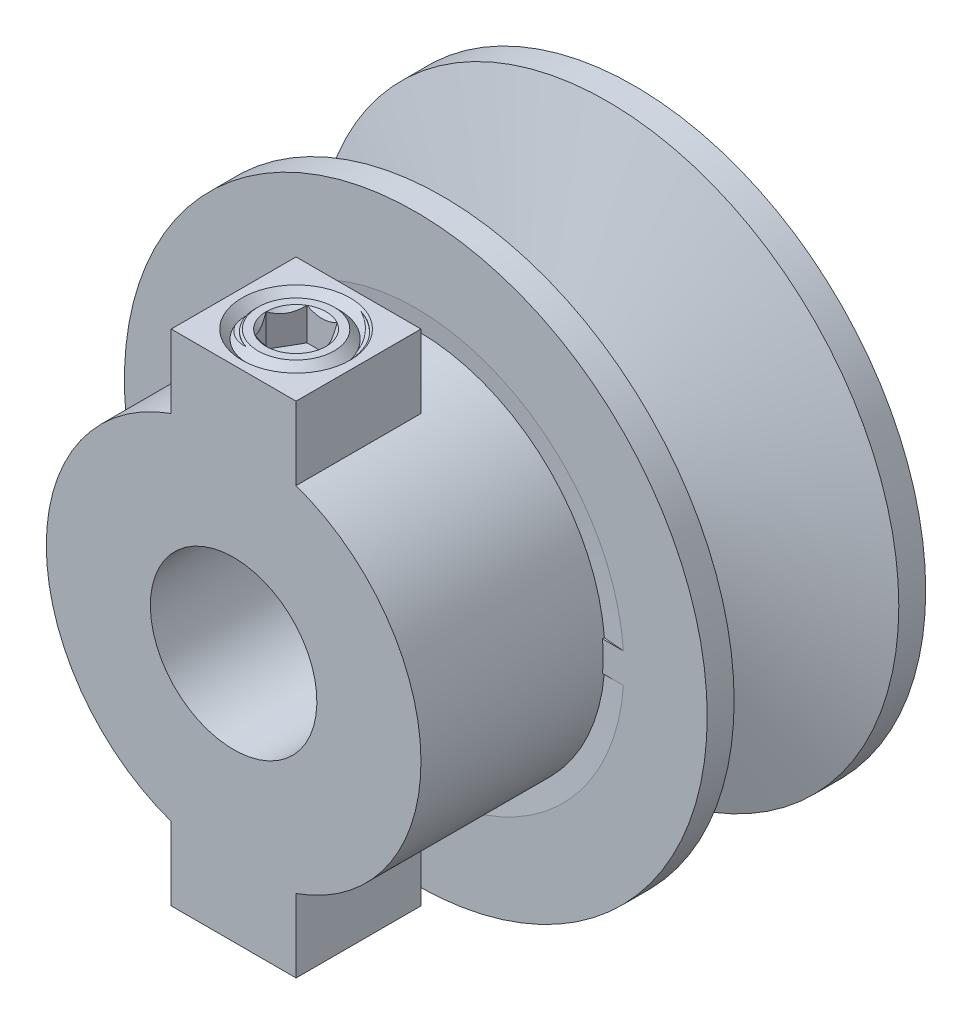
from build123d import *

# Parameters (mm, degrees)
BOSS_EXTRUDE1_DEPTH      = 1.143
CIRPATTERN1_COUNT        = 2
SKETCH3_R                = 6.35
CUT_EXTRUDE1_DEPTH       = 30.5562
BOSS_EXTRUDE2_REACH      = 54.94
BOSS_EXTRUDE2_END_RADIUS = 14.2875
BOSS_EXTRUDE2_START      = 4.7625
SKETCH5_W                = 9.525
SKETCH5_H                = 9.525
CUT_EXTRUDE3_REACH       = 53.88
CUT_EXTRUDE3_END_RADIUS  = 6.35
SKETCH6_R                = 3.086805556
CUT_SWEEP1_PITCH         = 1.411111111
CUT_SWEEP2_PITCH         = 1.411111111
CUT_EXTRUDE5_DEPTH       = 2.48046875


with BuildPart() as part:
    # Sketch1 → Revolve1 (revolve)
    with BuildSketch(Plane(origin=(0, 0, 0), x_dir=(0, 0, -1), z_dir=(1, 0, 0)), mode=Mode.PRIVATE) as revolve1_sk:
        Polygon((6.279294914, 22.225), (8.3312, 22.225), (8.3312, 15.875), (8.192311747, 14.2875), (8.3312, 14.2875), (8.3312, 0), (-22.225, 0), (-22.225, 14.2875), (-8.73125, 14.2875), (-8.192311747, 14.2875), (-8.3312, 15.875), (-8.3312, 22.225), (-6.279294914, 22.225), (-2.396515259, 9.525), (2.396515259, 9.525), align=None)
    revolve(revolve1_sk.sketch.rotate(Axis((0, 0, 22.225), (0, 0, -1)), 90), axis=Axis((0, 0, 22.225), (0, 0, -1)))

    # Sketch2 → Boss-Extrude1 (add, symmetric)
    with BuildSketch(Plane(origin=(0, 0, 0), x_dir=(0, 0, -1), z_dir=(0, 1, 0))):
        Polygon((-8.170089626, 14.0335), (-8.3312, 15.875), (-8.3312, 14.0335), align=None)
        Polygon((8.3312, 14.0335), (8.170089626, 14.0335), (8.3312, 15.875), align=None)
    boss_extrude1 = extrude(amount=BOSS_EXTRUDE1_DEPTH, both=True)

    # CirPattern1: Boss-Extrude1 ×2 about axis
    cirpattern1_axis = Axis((0, 0, 0), (0, 0, -1))
    for i in range(1, CIRPATTERN1_COUNT):
        add(boss_extrude1.rotate(cirpattern1_axis, i * 360 / CIRPATTERN1_COUNT))

    # Sketch3 → Cut-Extrude1 (cut)
    with BuildSketch(Plane(origin=(0, 0, -8.3312), x_dir=(-1, 0, 0), z_dir=(0, 0, -1))):
        with Locations(Location((0, 0, 0), (0, 0, 90))):
            Circle(SKETCH3_R)
    extrude(amount=-CUT_EXTRUDE1_DEPTH, mode=Mode.SUBTRACT)

    # Boss-Extrude2: up to this cylinder (the profile starts outside it)
    boss_extrude2_end = Plane(origin=(0, 0, 17.4625), z_dir=(0, 0, 1)) * Cylinder(BOSS_EXTRUDE2_END_RADIUS, 139.455, mode=Mode.PRIVATE)
    # Sketch5 → Boss-Extrude2 (add, up to the surface)
    with BuildSketch(Plane(origin=(0, 14.2875, 0), x_dir=(-1, 0, 0), z_dir=(0, 1, 0)).offset(BOSS_EXTRUDE2_START), mode=Mode.PRIVATE) as boss_extrude2_sk1:
        with Locations((0, 17.4625)):
            Rectangle(SKETCH5_W, SKETCH5_H)
    boss_extrude2_tool1 = extrude(boss_extrude2_sk1.sketch, amount=-BOSS_EXTRUDE2_REACH, mode=Mode.PRIVATE) - boss_extrude2_end
    boss_extrude2 = boss_extrude2_tool1.solids().sort_by_distance((0, 19.05, 17.4625))[0]
    add(boss_extrude2)

    # Mirror1: Boss-Extrude2 across plane
    add(boss_extrude2.mirror(Plane.ZX))

    # Cut-Extrude3: up to this cylinder (the profile starts outside it)
    cut_extrude3_end = Plane(origin=(0, 0, 17.4625), z_dir=(0, 0, -1)) * Cylinder(CUT_EXTRUDE3_END_RADIUS, 121.46, mode=Mode.PRIVATE)
    # Sketch6 → Cut-Extrude3 (cut, up to the surface)
    with BuildSketch(Plane(origin=(0, 19.05, 0), x_dir=(-1, 0, 0), z_dir=(0, 1, 0)), mode=Mode.PRIVATE) as cut_extrude3_sk1:
        with Locations(Location((0, 17.4625, 0), (0, 0, 90))):
            Circle(SKETCH6_R)
    cut_extrude3_tool1 = extrude(cut_extrude3_sk1.sketch, amount=-CUT_EXTRUDE3_REACH, mode=Mode.PRIVATE) - cut_extrude3_end
    add(cut_extrude3_tool1.solids().sort_by_distance((0, 19.05, 17.4625))[0], mode=Mode.SUBTRACT)

    # Cut-Sweep1: arcs per turn and ends read off the stored shape
    # Cut-Sweep1: the profile of Sketch8 screwed along a right-hand helix through 11.125 turns, 8 arcs to a turn; built about Z, then put on its axis
    cut_sweep1_z = Axis((0, 0, 0), (0, 0, 1))
    cut_sweep1_corners = [(2.975827818, 0, -1.367013889), (2.975827818, 0, -0.044097222), (3.96875, 0, -0.617361111), (3.96875, 0, -0.79375)]
    with BuildLine(mode=Mode.PRIVATE) as cut_sweep1_profile:
        Line(cut_sweep1_corners[0], cut_sweep1_corners[1])
        Line(cut_sweep1_corners[1], cut_sweep1_corners[2])
        Line(cut_sweep1_corners[2], cut_sweep1_corners[3])
        Line(cut_sweep1_corners[3], cut_sweep1_corners[0])
    cut_sweep1_cap = Face(cut_sweep1_profile.wire())
    cut_sweep1_turn_angles = [0, 22.5, 45, 67.5, 90, 112.5, 135, 157.5, 180, 202.5, 225, 247.5, 270, 292.5, 315, 337.5, 360]
    cut_sweep1_turn_weights = [1, 0.9238795325112867, 1, 0.9238795325112867, 1, 0.9238795325112867, 1, 0.9238795325112867, 1, 0.9238795325112867, 1, 0.9238795325112867, 1, 0.9238795325112867, 1, 0.9238795325112867, 1]
    cut_sweep1_turn_rails = [Edge.make_bspline([Vector(p[0], p[1], 0).rotate(cut_sweep1_z, cut_sweep1_turn_angles[k]) / cut_sweep1_turn_weights[k] + Vector(0, 0, p[2] + CUT_SWEEP1_PITCH * cut_sweep1_turn_angles[k] / 360) for k in range(17)], [0, 0, 0, 1, 1, 2, 2, 3, 3, 4, 4, 5, 5, 6, 6, 7, 7, 8, 8, 8], 2, cut_sweep1_turn_weights) for p in cut_sweep1_corners]
    cut_sweep1_turn_sides = [Face.make_surface_from_curves(cut_sweep1_turn_rails[p[0]], cut_sweep1_turn_rails[p[1]]) for p in [(0, 1), (1, 2), (2, 3), (3, 0)]]
    cut_sweep1_last_angles = [3960, 3982.5, 4005]
    cut_sweep1_last_weights = [1, 0.9238795325112594, 1]
    cut_sweep1_last_rails = [Edge.make_bspline([Vector(p[0], p[1], 0).rotate(cut_sweep1_z, cut_sweep1_last_angles[k]) / cut_sweep1_last_weights[k] + Vector(0, 0, p[2] + CUT_SWEEP1_PITCH * cut_sweep1_last_angles[k] / 360) for k in range(3)], [0, 0, 0, 1, 1, 1], 2, cut_sweep1_last_weights) for p in cut_sweep1_corners]
    cut_sweep1_last_sides = [Face.make_surface_from_curves(cut_sweep1_last_rails[p[0]], cut_sweep1_last_rails[p[1]]) for p in [(0, 1), (1, 2), (2, 3), (3, 0)]]
    cut_sweep1 = Plane(origin=(0, 19.05, 17.4625), x_dir=(0, 0, 1), z_dir=(0, -1, 0)) * Solid(Shell([*[p.moved(Location((0, 0, CUT_SWEEP1_PITCH * i))) for i in range(11) for p in cut_sweep1_turn_sides], *cut_sweep1_last_sides, cut_sweep1_cap, cut_sweep1_cap.rotate(cut_sweep1_z, 4005).moved(Location((0, 0, CUT_SWEEP1_PITCH * 4005 / 360)))]))
    add(cut_sweep1, mode=Mode.SUBTRACT)

    # Cut-Extrude4 cone 1 section (through the dimple's axis) → Cut-Extrude4 (revolve, cut)
    with BuildSketch(Plane(origin=(0, 19.05, 17.4625), x_dir=(0, 0, 1), z_dir=(1, 0, 0))):
        Polygon((0, 0), (4.121507259, 0), (0, 4.121507259), align=None)
    revolve(axis=Axis((0, 19.05, 17.4625), (0, -1, 0)), mode=Mode.SUBTRACT)


with BuildPart() as body_2:
    # Sketch10 → Revolve3 (revolve)
    with BuildSketch(Plane(origin=(0, 0, 0), x_dir=(0, 0, -1), z_dir=(1, 0, 0))):
        Polygon((-21.43125, 7.419300811), (-21.43125, 17.980699189), (-20.361949189, 19.05), (-17.4625, 19.05), (-17.4625, 6.35), (-20.361949189, 6.35), align=None)
    revolve(axis=Axis((0, 19.05, 17.4625), (0, -1, 0)))

    # Cut-Sweep2: arcs per turn and ends read off the stored shape
    # Cut-Sweep2: the profile of Sketch12 screwed along a right-hand helix through 10 turns, 8 arcs to a turn; built about Z, then put on its axis
    cut_sweep2_z = Axis((0, 0, 0), (0, 0, 1))
    cut_sweep2_corners = [(4.045128629, 0, -0.661458333), (4.045128629, 0, 0.661458333), (3.052206448, 0, 0.088194444), (3.052206448, 0, -0.088194444)]
    with BuildLine(mode=Mode.PRIVATE) as cut_sweep2_profile:
        Line(cut_sweep2_corners[0], cut_sweep2_corners[1])
        Line(cut_sweep2_corners[1], cut_sweep2_corners[2])
        Line(cut_sweep2_corners[2], cut_sweep2_corners[3])
        Line(cut_sweep2_corners[3], cut_sweep2_corners[0])
    cut_sweep2_cap = Face(cut_sweep2_profile.wire())
    cut_sweep2_turn_angles = [0, 22.5, 45, 67.5, 90, 112.5, 135, 157.5, 180, 202.5, 225, 247.5, 270, 292.5, 315, 337.5, 360]
    cut_sweep2_turn_weights = [1, 0.9238795325112867, 1, 0.9238795325112867, 1, 0.9238795325112867, 1, 0.9238795325112867, 1, 0.9238795325112867, 1, 0.9238795325112867, 1, 0.9238795325112867, 1, 0.9238795325112867, 1]
    cut_sweep2_turn_rails = [Edge.make_bspline([Vector(p[0], p[1], 0).rotate(cut_sweep2_z, cut_sweep2_turn_angles[k]) / cut_sweep2_turn_weights[k] + Vector(0, 0, p[2] + CUT_SWEEP2_PITCH * cut_sweep2_turn_angles[k] / 360) for k in range(17)], [0, 0, 0, 1, 1, 2, 2, 3, 3, 4, 4, 5, 5, 6, 6, 7, 7, 8, 8, 8], 2, cut_sweep2_turn_weights) for p in cut_sweep2_corners]
    cut_sweep2_turn_sides = [Face.make_surface_from_curves(cut_sweep2_turn_rails[p[0]], cut_sweep2_turn_rails[p[1]]) for p in [(0, 1), (1, 2), (2, 3), (3, 0)]]
    cut_sweep2 = Plane(origin=(0, 19.05, 17.4625), x_dir=(0, 0, 1), z_dir=(0, -1, 0)) * Solid(Shell([*[p.moved(Location((0, 0, CUT_SWEEP2_PITCH * i))) for i in range(10) for p in cut_sweep2_turn_sides], cut_sweep2_cap, cut_sweep2_cap.rotate(cut_sweep2_z, 3600).moved(Location((0, 0, CUT_SWEEP2_PITCH * 3600 / 360)))]))
    add(cut_sweep2, mode=Mode.SUBTRACT)

    # Sketch13 → Cut-Extrude5 (cut)
    with BuildSketch(Plane(origin=(0, 19.05, 0), x_dir=(1, 0, 0), z_dir=(0, 1, 0))):
        Polygon((2.291358881, -17.4625), (1.14567944, -15.478125), (-1.14567944, -15.478125), (-2.291358881, -17.4625), (-1.14567944, -19.446875), (1.14567944, -19.446875), align=None)
    extrude(amount=-CUT_EXTRUDE5_DEPTH, mode=Mode.SUBTRACT)

    # Cut-Extrude6 cone 1 section (through the dimple's axis) → Cut-Extrude6 (revolve, cut)
    with BuildSketch(Plane(origin=(0, 19.05, 17.4625), x_dir=(0, 0, 1), z_dir=(1, 0, 0))):
        Polygon((0, 0), (2.291358881, 0), (0, 2.291358881), align=None)
    revolve(axis=Axis((0, 19.05, 17.4625), (0, -1, 0)), mode=Mode.SUBTRACT)


solid = Compound([part.part, body_2.part])
